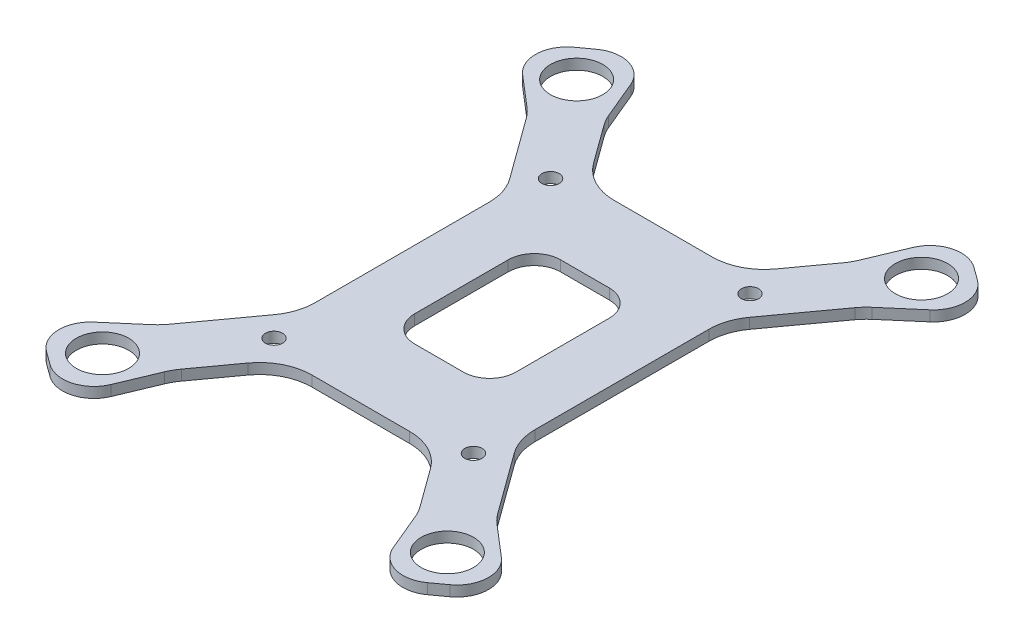
from build123d import *

# Parameters (mm, degrees)
SKETCH_1_W             = 42
SKETCH_1_H             = 57.75
EXTRUDE_1_DEPTH        = 2
EXTRUDE_2_DEPTH        = 2
SKETCH_8_W             = 19.31744652
SKETCH_8_H             = 27.856514232
CUT_EXTRUDE_4_DEPTH    = 9
FILLET_4_R             = 5
SKETCH_5_R             = 5
CUT_EXTRUDE_6_DEPTH    = 10
EXTRUDE_3_DEPTH        = 2
FILLET_5_R             = 10
FILLET_6_R             = 6
FILLET_5_OF_MIRROR_1_R = 10
FILLET_6_OF_MIRROR_1_R = 6
MIRROR_2_OUTLINE_R     = 5
MIRROR_2_DEPTH         = 2
SKETCH_3_R             = 1.65
CUT_EXTRUDE_1_DEPTH    = 68.321095486
FILLET_7_R             = 10


# Read off the part's stored shape, not the designer's step: 镜向2
with BuildPart() as part:
    # 草图1 → 凸台-拉伸1 (new body)
    with BuildSketch(Plane(origin=(0, 0, 0), x_dir=(1, 0, 0), z_dir=(0, 1, 0))):
        Rectangle(SKETCH_1_W, SKETCH_1_H)
    extrude(amount=EXTRUDE_1_DEPTH)

    # 草图2 → 凸台-拉伸2 (add)
    with BuildSketch(Plane(origin=(0, 2, 0), x_dir=(1, 0, 0), z_dir=(0, 1, 0))):
        Polygon((-12.413267133, 26.094069469), (-21, 19.849172839), (-41.586009419, 48.154935789), (-32.999276552, 54.39983242), align=None)
    extrude_2 = extrude(amount=-EXTRUDE_2_DEPTH)

    # 草图8 → 切除-拉伸4 (cut)
    with BuildSketch(Plane(origin=(0, 2, 0), x_dir=(1, 0, 0), z_dir=(0, 1, 0))):
        Rectangle(SKETCH_8_W, SKETCH_8_H)
    extrude(amount=-CUT_EXTRUDE_4_DEPTH, mode=Mode.SUBTRACT)

    # 圆角4
    fillet_4_edges = [part.edges().sort_by_distance(p)[0] for p in [
        (-9.65872326, 1, 13.928257116),
        (-9.65872326, 1, -13.928257116),
        (9.65872326, 1, -13.928257116),
        (9.65872326, 1, 13.928257116),
    ]]
    fillet(fillet_4_edges, radius=FILLET_4_R)

    # 草图5 → 切除-拉伸6 (cut)
    with BuildSketch(Plane(origin=(0, 2, 0), x_dir=(1, 0, 0), z_dir=(0, 1, 0))):
        with Locations(Location((-32.934365155, 45.284752088, 0), (0, 0, 270))):
            Circle(SKETCH_5_R)
    cut_extrude_6 = extrude(amount=-CUT_EXTRUDE_6_DEPTH, mode=Mode.SUBTRACT)

    # 草图9 → 凸台-拉伸3 (add)
    with BuildSketch(Plane(origin=(0, 2, 0), x_dir=(1, 0, 0), z_dir=(0, 1, 0))):
        Polygon((-32.07479568, 35.077016899), (-44.691673686, 45.896270868), (-41.586009419, 48.154935789), align=None)
        Polygon((-23.488062813, 41.321913529), (-29.893612284, 56.658497342), (-32.999276552, 54.39983242), align=None)
    extrude_3 = extrude(amount=-EXTRUDE_3_DEPTH)

    # 圆角5
    fillet_5_edges = [part.edges().sort_by_distance(p)[0] for p in [
        (-32.07479568, 1, -35.077016899),
        (-23.488062813, 1, -41.321913529),
    ]]
    fillet(fillet_5_edges, radius=FILLET_5_R)

    # 圆角6
    fillet_6_edges = [part.edges().sort_by_distance(p)[0] for p in [
        (-44.691673686, 1, -45.896270868),
        (-29.893612284, 1, -56.658497342),
    ]]
    fillet(fillet_6_edges, radius=FILLET_6_R)

    # 镜向1: 凸台-拉伸2, 切除-拉伸6, 凸台-拉伸3 across plane
    add(extrude_2.mirror(Plane(origin=(0, 0, 0), x_dir=(0, 0, 1), z_dir=(1, 0, 0))))
    add(cut_extrude_6.mirror(Plane(origin=(0, 0, 0), x_dir=(0, 0, 1), z_dir=(1, 0, 0))), mode=Mode.SUBTRACT)
    add(extrude_3.mirror(Plane(origin=(0, 0, 0), x_dir=(0, 0, 1), z_dir=(1, 0, 0))))

    # 圆角5 of 镜向1
    fillet_5_of_mirror_1_edges = [part.edges().sort_by_distance(p)[0] for p in [
        (32.07479568, 1, -35.077016899),
        (23.488062813, 1, -41.321913529),
    ]]
    fillet(fillet_5_of_mirror_1_edges, radius=FILLET_5_OF_MIRROR_1_R)

    # 圆角6 of 镜向1
    fillet_6_of_mirror_1_edges = [part.edges().sort_by_distance(p)[0] for p in [
        (44.691673686, 1, -45.896270868),
        (29.893612284, 1, -56.658497342),
    ]]
    fillet(fillet_6_of_mirror_1_edges, radius=FILLET_6_OF_MIRROR_1_R)

    # 镜向2 outline → 镜向2 (add)
    # profile 1 of 2: a face of its own
    with BuildSketch(Plane(origin=(0, 0, 0), x_dir=(1, 0, 0), z_dir=(0, 1, 0))):
        with BuildLine():
            Line((21, -28.875), (14.435762065, -28.875))
            Line((14.435762065, -28.875), (22.799263539, -40.374814527))
            ThreePointArc((22.799263539, -40.374814527), (23.428494894, -41.355407098), (23.939399044, -42.402532133))
            Line((23.939399044, -42.402532133), (26.967769787, -49.653254641))
            ThreePointArc((26.967769787, -49.653254641), (30.885501706, -53.118362872), (36.033297782, -52.193271525))
            Line((36.033297782, -52.193271525), (38.551988188, -50.361496684))
            ThreePointArc((38.551988188, -50.361496684), (41.018152801, -45.749162076), (38.928702373, -40.954394579))
            Line((38.928702373, -40.954394579), (32.963783297, -35.839343585))
            ThreePointArc((32.963783297, -35.839343585), (32.12501319, -35.030666519), (31.385996405, -34.129917896))
            Line((31.385996405, -34.129917896), (21, -19.849172839))
            Line((21, -19.849172839), (21, -28.875))
        make_face()
        with Locations((32.934365155, -45.284752088)):
            Circle(MIRROR_2_OUTLINE_R, mode=Mode.SUBTRACT)
    # profile 2 of 2: a face of its own
    with BuildSketch(Plane(origin=(0, 0, 0), x_dir=(1, 0, 0), z_dir=(0, 1, 0))):
        with BuildLine():
            Line((-22.799263539, -40.374814527), (-14.435762065, -28.875))
            Line((-14.435762065, -28.875), (-21, -28.875))
            Line((-21, -28.875), (-21, -19.849172839))
            Line((-21, -19.849172839), (-31.385996405, -34.129917896))
            ThreePointArc((-31.385996405, -34.129917896), (-32.12501319, -35.030666519), (-32.963783297, -35.839343585))
            Line((-32.963783297, -35.839343585), (-38.928702373, -40.954394579))
            ThreePointArc((-38.928702373, -40.954394579), (-41.018152801, -45.749162076), (-38.551988188, -50.361496684))
            Line((-38.551988188, -50.361496684), (-36.033297782, -52.193271525))
            ThreePointArc((-36.033297782, -52.193271525), (-30.885501706, -53.118362872), (-26.967769787, -49.653254641))
            Line((-26.967769787, -49.653254641), (-23.939399044, -42.402532133))
            ThreePointArc((-23.939399044, -42.402532133), (-23.428494894, -41.355407098), (-22.799263539, -40.374814527))
        make_face()
        with Locations((-32.934365155, -45.284752088)):
            Circle(MIRROR_2_OUTLINE_R, mode=Mode.SUBTRACT)
    extrude(amount=MIRROR_2_DEPTH)

    # 草图3 → 切除-拉伸1 (cut, through all)
    with BuildSketch(Plane(origin=(0, 2, 0), x_dir=(1, 0, 0), z_dir=(0, 1, 0))):
        with Locations(Location((19.05, 26.415, 0), (0, 0, 270))):
            Circle(SKETCH_3_R)
        with Locations(Location((19.05, -26.415, 0), (0, 0, 90))):
            Circle(SKETCH_3_R)
        with Locations(Location((-19.05, -26.415, 0), (0, 0, 270))):
            Circle(SKETCH_3_R)
        with Locations(Location((-19.05, 26.415, 0), (0, 0, 90))):
            Circle(SKETCH_3_R)
    extrude(amount=-CUT_EXTRUDE_1_DEPTH, mode=Mode.SUBTRACT)

    # 圆角7
    fillet_7_edges = [part.edges().sort_by_distance(p)[0] for p in [
        (14.435762065, 1, -28.875),
        (21, 1, -19.849172839),
        (-21, 1, -19.849172839),
        (-14.435762065, 1, -28.875),
        (21, 1, 19.849172839),
        (14.435762065, 1, 28.875),
        (-14.435762065, 1, 28.875),
        (-21, 1, 19.849172839),
    ]]
    fillet(fillet_7_edges, radius=FILLET_7_R)


solid = part.part
